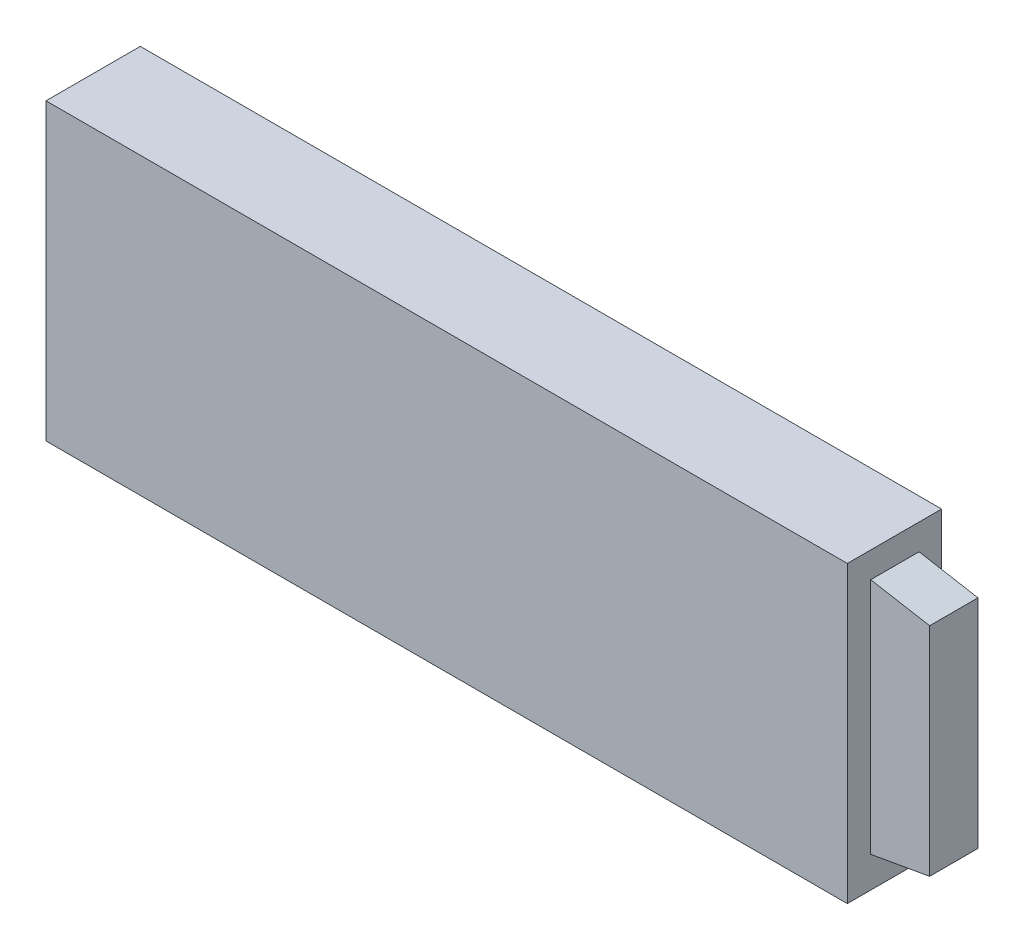
from build123d import *

# Parameters (mm, degrees)
SKETCH1_W           = 68
SKETCH1_H           = 25
BOSS_EXTRUDE1_DEPTH = 8
SKETCH13_W          = 4.102736362
SKETCH13_H          = 20.181027508
BOSS_EXTRUDE5_DEPTH = 5
CHAMFER1_SIZE2      = 0.881634904
CHAMFER1_SIZE       = 5
CHAMFER2_SIZE2      = 5
CHAMFER2_SIZE       = 0.881634904


with BuildPart() as part:
    # Sketch1 → Boss-Extrude1 (new body)
    with BuildSketch(Plane(origin=(0, 0, 0), x_dir=(1, 0, 0), z_dir=(0, 0, -1))):
        with Locations((34, 12.5)):
            Rectangle(SKETCH1_W, SKETCH1_H)
    extrude(amount=BOSS_EXTRUDE1_DEPTH)

    # Sketch13 → Boss-Extrude5 (add)
    with BuildSketch(Plane(origin=(68, 0, 0), x_dir=(0, 0, -1), z_dir=(1, 0, 0))):
        with Locations((4.036961589, -12.278230467)):
            Rectangle(SKETCH13_W, SKETCH13_H)
    extrude(amount=BOSS_EXTRUDE5_DEPTH)

    # Chamfer1
    chamfer1_edges = [part.edges().sort_by_distance(p)[0] for p in [
        (73, -2.187716713, -4.036961589),
    ]]
    chamfer1_side = [part.faces().sort_by_distance(p)[0] for p in [
        (72.982367302, -2.187716713, -4.036961589),
    ]]
    chamfer(chamfer1_edges, length=CHAMFER1_SIZE - 0.0001, length2=CHAMFER1_SIZE2 - 0.0001, reference=chamfer1_side[0])  # a hair under: the kernel refuses the full size

    # Chamfer2
    chamfer2_edges = [part.edges().sort_by_distance(p)[0] for p in [
        (73, -22.368744221, -4.036961589),
    ]]
    chamfer2_side = [part.faces().sort_by_distance(p)[0] for p in [
        (73, -22.351111523, -4.036961589),
    ]]
    chamfer(chamfer2_edges, length=CHAMFER2_SIZE - 0.0001, length2=CHAMFER2_SIZE2 - 0.0001, reference=chamfer2_side[0])  # a hair under: the kernel refuses the full size


solid = part.part
